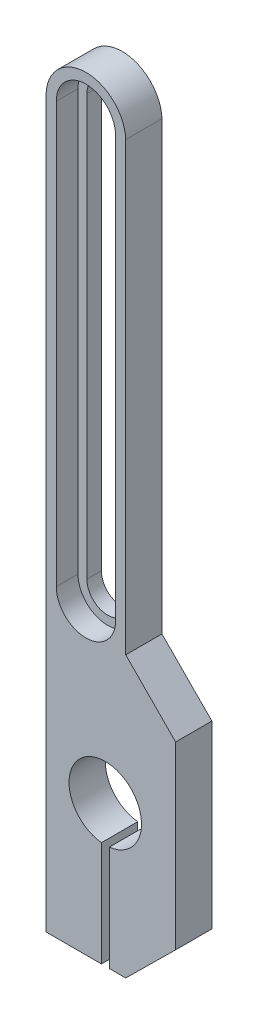
from build123d import *

# Parameters (mm, degrees)
BOSS_EXTRUDE1_DEPTH = 10
CUT_EXTRUDE1_DEPTH  = 6
SKETCH3_R           = 10
CUT_EXTRUDE2_DEPTH  = 100
SKETCH4_W           = 2.168079082
SKETCH4_H           = 52.416620737
CUT_EXTRUDE3_DEPTH  = 100


with BuildPart() as part:
    # Sketch1 → Boss-Extrude1 (new body)
    with BuildSketch(Plane.XY):
        with BuildLine():
            Line((-10.168282944, -74.540074159), (-10.168282944, 125.873502567))
            ThreePointArc((-10.168282944, 125.873502567), (0.820022818, 136.456011928), (11.80832858, 125.873502567))
            Line((11.80832858, 125.873502567), (11.80832858, 2.708051258))
            Line((11.80832858, 2.708051258), (25.584711922, -11.234312607))
            Line((25.584711922, -11.234312607), (25.584711922, -60.927695379))
            Line((25.584711922, -60.927695379), (11.80832858, -74.540074159))
            Line((11.80832858, -74.540074159), (-10.168282944, -74.540074159))
        make_face()
        with BuildLine():
            Line((6.560182544, 125.459925841), (6.560182544, 9.430262407))
            ThreePointArc((6.560182544, 9.430262407), (0.820022818, 3.690102681), (-4.920136908, 9.430262407))
            Line((-4.920136908, 9.430262407), (-4.920136908, 125.459925841))
            ThreePointArc((-4.920136908, 125.459925841), (0.820022818, 131.200085568), (6.560182544, 125.459925841))
        make_face(mode=Mode.SUBTRACT)
    extrude(amount=BOSS_EXTRUDE1_DEPTH)

    # Sketch2 → Cut-Extrude1 (cut)
    with BuildSketch(Plane.XY.offset(10)):
        with BuildLine():
            Line((9.002933369, 125.459925841), (9.002933369, 9.430262407))
            ThreePointArc((9.002933369, 9.430262407), (0.820022818, 1.247351856), (-7.362887733, 9.430262407))
            Line((-7.362887733, 9.430262407), (-7.362887733, 125.459925841))
            ThreePointArc((-7.362887733, 125.459925841), (0.820022818, 133.642836393), (9.002933369, 125.459925841))
        make_face()
    extrude(amount=-CUT_EXTRUDE1_DEPTH, mode=Mode.SUBTRACT)

    # Sketch3 → Cut-Extrude2 (cut)
    with BuildSketch(Plane.XY.offset(10)):
        with Locations((6.152504118, -35.590398018)):
            Circle(SKETCH3_R)
    extrude(amount=-CUT_EXTRUDE2_DEPTH, mode=Mode.SUBTRACT)

    # Sketch4 → Cut-Extrude3 (cut)
    with BuildSketch(Plane.XY.offset(10)):
        with Locations((6.188801014, -52.416791412)):
            Rectangle(SKETCH4_W, SKETCH4_H)
    extrude(amount=-CUT_EXTRUDE3_DEPTH, mode=Mode.SUBTRACT)


solid = part.part
